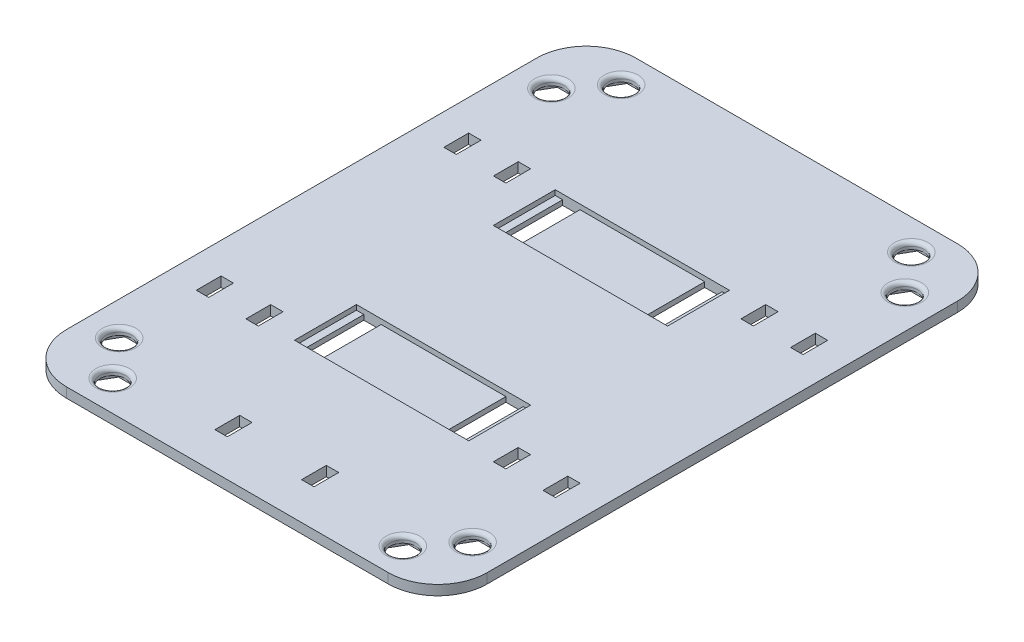
from build123d import *

# Parameters (mm, degrees)
SKETCH1_W           = 107.95
SKETCH1_H           = 146.05
BOSS_EXTRUDE1_DEPTH = 2.54
SKETCH2_R           = 3.302
CUT_EXTRUDE1_DEPTH  = 91.842736914
SKETCH3_W           = 4.445
SKETCH3_H           = 15.875
CUT_EXTRUDE2_DEPTH  = 91.842736914
FILLET1_R           = 12.7
SKETCH11_W          = 44.699936
SKETCH11_H          = 15.875
CUT_EXTRUDE9_DEPTH  = 1.27
FILLET2_R           = 1.016
SKETCH14_W          = 3.175
SKETCH14_H          = 6.35
CUT_EXTRUDE14_DEPTH = 91.842736914
CUT_EXTRUDE15_DEPTH = 0.79375


with BuildPart() as part:
    # Sketch1 → Boss-Extrude1 (new body)
    with BuildSketch(Plane(origin=(0, 0, 0), x_dir=(1, 0, 0), z_dir=(0, 1, 0))):
        Rectangle(SKETCH1_W, SKETCH1_H)
    extrude(amount=-BOSS_EXTRUDE1_DEPTH)

    # Sketch2 → Cut-Extrude1 (cut, through all)
    with BuildSketch(Plane(origin=(0, 0, 0), x_dir=(1, 0, 0), z_dir=(0, 1, 0))):
        with Locations((-37.218937681, 65.210784985)):
            Circle(SKETCH2_R)
        with Locations((45.326413441, 55.435363088)):
            Circle(SKETCH2_R)
        with Locations((37.218937681, 65.210784985)):
            Circle(SKETCH2_R)
        with Locations((-45.326413441, -55.435363088)):
            Circle(SKETCH2_R)
        with Locations((-45.326413441, 55.435363088)):
            Circle(SKETCH2_R)
        with Locations((-37.218937681, -65.210784985)):
            Circle(SKETCH2_R)
        with Locations((37.218937681, -65.210784985)):
            Circle(SKETCH2_R)
        with Locations((45.326413441, -55.435363088)):
            Circle(SKETCH2_R)
    extrude(amount=-CUT_EXTRUDE1_DEPTH, mode=Mode.SUBTRACT)

    # Sketch3 → Cut-Extrude2 (cut, through all)
    with BuildSketch(Plane(origin=(0, 0, 0), x_dir=(1, 0, 0), z_dir=(0, 1, 0))):
        with Locations((-18.222468, 25.499949)):
            Rectangle(SKETCH3_W, SKETCH3_H)
        with Locations((18.222468, 25.499949)):
            Rectangle(SKETCH3_W, SKETCH3_H)
        with Locations((18.222468, -25.499949)):
            Rectangle(SKETCH3_W, SKETCH3_H)
        with Locations((-18.222468, -25.499949)):
            Rectangle(SKETCH3_W, SKETCH3_H)
    extrude(amount=-CUT_EXTRUDE2_DEPTH, mode=Mode.SUBTRACT)

    # Fillet1
    fillet1_edges = [part.edges().sort_by_distance(p)[0] for p in [
        (53.975, -1.27, -73.025),
        (53.975, -1.27, 73.025),
        (-53.975, -1.27, 73.025),
        (-53.975, -1.27, -73.025),
    ]]
    fillet(fillet1_edges, radius=FILLET1_R)

    # Sketch11 → Cut-Extrude9 (cut, symmetric)
    with BuildSketch(Plane(origin=(0, 0, 0), x_dir=(1, 0, 0), z_dir=(0, 1, 0))):
        with Locations((0, -25.499949)):
            Rectangle(SKETCH11_W, SKETCH11_H)
        with Locations((0, 25.499949)):
            Rectangle(SKETCH11_W, SKETCH11_H)
    extrude(amount=CUT_EXTRUDE9_DEPTH, both=True, mode=Mode.SUBTRACT)

    # Fillet2
    fillet2_edges = [part.edges().sort_by_distance(p)[0] for p in [
        (-40.520937681, 0, -65.210784985),
        (33.916937681, 0, 65.210784985),
        (42.024413441, 0, 55.435363088),
        (-40.520937681, 0, 65.210784985),
        (-48.628413441, 0, 55.435363088),
        (42.024413441, 0, -55.435363088),
        (33.916937681, 0, -65.210784985),
        (-48.628413441, 0, -55.435363088),
    ]]
    fillet(fillet2_edges, radius=FILLET2_R)

    # Sketch14 → Cut-Extrude14 (cut, through all)
    with BuildSketch(Plane(origin=(0, 0, 0), x_dir=(1, 0, 0), z_dir=(0, 1, 0))):
        with Locations((31.7373, -31.75)):
            Rectangle(SKETCH14_W, SKETCH14_H)
        with Locations((-31.7373, -31.75)):
            Rectangle(SKETCH14_W, SKETCH14_H)
        with Locations((-31.7373, 31.75)):
            Rectangle(SKETCH14_W, SKETCH14_H)
        with Locations((31.7373, 31.75)):
            Rectangle(SKETCH14_W, SKETCH14_H)
        with Locations((-11.1125, -60.325)):
            Rectangle(SKETCH14_W, SKETCH14_H)
        with Locations((11.1125, -60.325)):
            Rectangle(SKETCH14_W, SKETCH14_H)
        with Locations((44.4627, 31.75)):
            Rectangle(SKETCH14_W, SKETCH14_H)
        with Locations((44.4627, -31.75)):
            Rectangle(SKETCH14_W, SKETCH14_H)
        with Locations((-44.4627, 31.75)):
            Rectangle(SKETCH14_W, SKETCH14_H)
        with Locations((-44.4627, -31.75)):
            Rectangle(SKETCH14_W, SKETCH14_H)
    extrude(amount=-CUT_EXTRUDE14_DEPTH, mode=Mode.SUBTRACT)

    # Sketch17 → Cut-Extrude15 (cut)
    with BuildSketch(Plane.XZ.offset(2.54)):
        Polygon((43.273355884, -51.879363088), (47.379470998, -51.879363088), (49.432528556, -55.435363088), (47.379470998, -58.991363088), (43.273355884, -58.991363088), (41.220298327, -55.435363088), align=None)
        Polygon((-41.220298327, -55.435363088), (-43.273355884, -51.879363088), (-47.379470998, -51.879363088), (-49.432528556, -55.435363088), (-47.379470998, -58.991363088), (-43.273355884, -58.991363088), align=None)
        Polygon((-33.112822567, -65.210784985), (-35.165880124, -61.654784985), (-39.271995239, -61.654784985), (-41.325052796, -65.210784985), (-39.271995239, -68.766784985), (-35.165880124, -68.766784985), align=None)
        Polygon((35.165880124, -61.654784985), (39.271995239, -61.654784985), (41.325052796, -65.210784985), (39.271995239, -68.766784985), (35.165880124, -68.766784985), (33.112822567, -65.210784985), align=None)
        Polygon((-41.220298327, 55.435363088), (-43.273355884, 51.879363088), (-47.379470998, 51.879363088), (-49.432528556, 55.435363088), (-47.379470998, 58.991363088), (-43.273355884, 58.991363088), align=None)
        Polygon((-33.112822567, 65.210784985), (-35.165880124, 61.654784985), (-39.271995239, 61.654784985), (-41.325052796, 65.210784985), (-39.271995239, 68.766784985), (-35.165880124, 68.766784985), align=None)
        Polygon((39.271995239, 68.766784985), (35.165880124, 68.766784985), (33.112822567, 65.210784985), (35.165880124, 61.654784985), (39.271995239, 61.654784985), (41.325052796, 65.210784985), align=None)
        Polygon((47.379470998, 58.991363088), (43.273355884, 58.991363088), (41.220298327, 55.435363088), (43.273355884, 51.879363088), (47.379470998, 51.879363088), (49.432528556, 55.435363088), align=None)
    extrude(amount=-CUT_EXTRUDE15_DEPTH, mode=Mode.SUBTRACT)


solid = part.part
